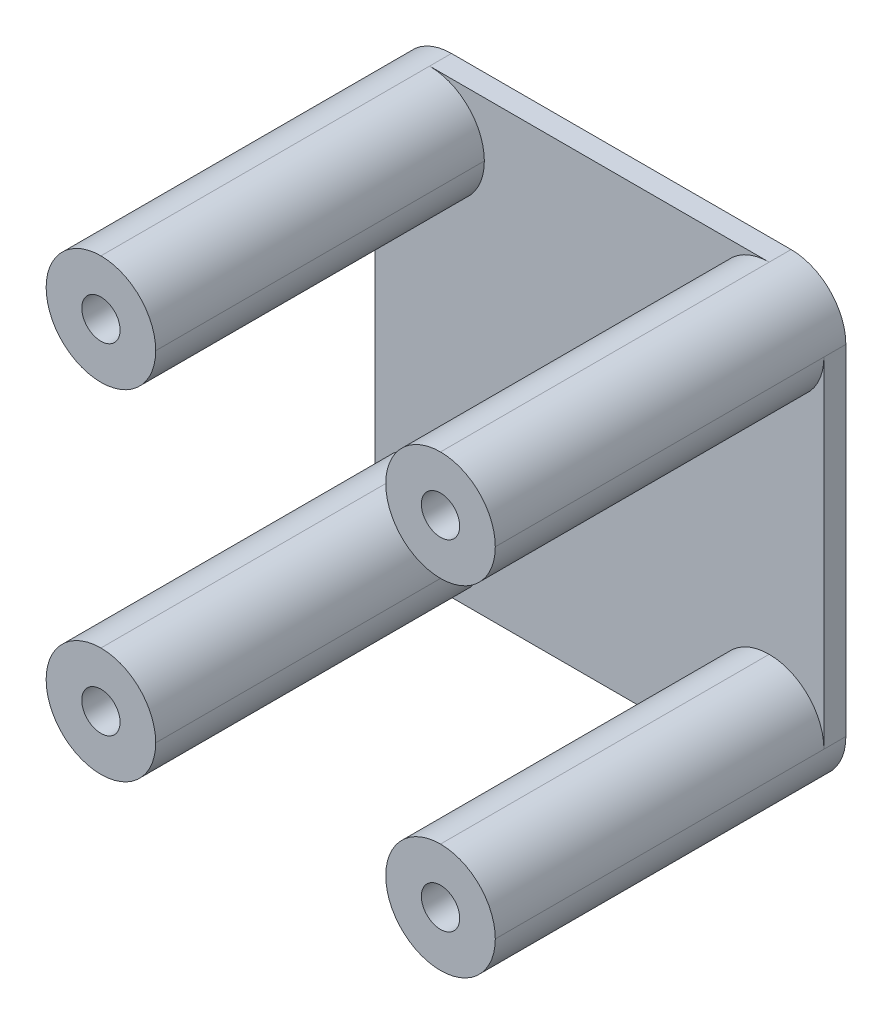
from build123d import *

# Parameters (mm, degrees)
SKETCH1_W           = 41
SKETCH1_H           = 41
SKETCH1_R           = 1.75
SKETCH1_R_2         = 1.25
BOSS_EXTRUDE1_DEPTH = 2
SKETCH2_W           = 10
SKETCH2_H           = 10
SKETCH2_R           = 1.75
BOSS_EXTRUDE2_DEPTH = 30
FILLET1_R           = 5


with BuildPart() as part:
    # Sketch1 → Boss-Extrude1 (new body)
    with BuildSketch(Plane.XY):
        with Locations((-34.508333333, 4.35625)):
            Rectangle(SKETCH1_W, SKETCH1_H)
        with Locations((-50.008333333, 19.85625)):
            Circle(SKETCH1_R, mode=Mode.SUBTRACT)
        with Locations((-50.008333333, -11.14375)):
            Circle(SKETCH1_R, mode=Mode.SUBTRACT)
        with Locations((-19.008333333, -11.14375)):
            Circle(SKETCH1_R, mode=Mode.SUBTRACT)
        with Locations((-19.008333333, 19.85625)):
            Circle(SKETCH1_R, mode=Mode.SUBTRACT)
        with Locations((-34.508333333, 4.35625)):
            Circle(SKETCH1_R_2, mode=Mode.SUBTRACT)
    extrude(amount=BOSS_EXTRUDE1_DEPTH)

    # Sketch2 → Boss-Extrude2 (add)
    # profile 1 of 4: a face of its own
    with BuildSketch(Plane.XY.offset(2)):
        with Locations((-50.008333333, 19.85625)):
            Rectangle(SKETCH2_W, SKETCH2_H)
        with Locations((-50.008333333, 19.85625)):
            Circle(SKETCH2_R, mode=Mode.SUBTRACT)
    # profile 2 of 4: a face of its own
    with BuildSketch(Plane.XY.offset(2)):
        with Locations((-50.008333333, -11.14375)):
            Rectangle(SKETCH2_W, SKETCH2_H)
        with Locations((-50.008333333, -11.14375)):
            Circle(SKETCH2_R, mode=Mode.SUBTRACT)
    # profile 3 of 4: a face of its own
    with BuildSketch(Plane.XY.offset(2)):
        with Locations((-19.008333333, -11.14375)):
            Rectangle(SKETCH2_W, SKETCH2_H)
        with Locations((-19.008333333, -11.14375)):
            Circle(SKETCH2_R, mode=Mode.SUBTRACT)
    # profile 4 of 4: a face of its own
    with BuildSketch(Plane.XY.offset(2)):
        with Locations((-19.008333333, 19.85625)):
            Rectangle(SKETCH2_W, SKETCH2_H)
        with Locations((-19.008333333, 19.85625)):
            Circle(SKETCH2_R, mode=Mode.SUBTRACT)
    extrude(amount=BOSS_EXTRUDE2_DEPTH)

    # Fillet1
    fillet1_edges = [part.edges().sort_by_distance(p)[0] for p in [
        (-24.008333333, 24.85625, 17),
        (-24.008333333, -6.14375, 17),
        (-55.008333333, -6.14375, 17),
        (-55.008333333, 14.85625, 17),
        (-45.008333333, 24.85625, 17),
        (-45.008333333, -6.14375, 17),
        (-45.008333333, -16.14375, 17),
        (-24.008333333, -16.14375, 17),
        (-14.008333333, -6.14375, 17),
        (-14.008333333, 14.85625, 17),
        (-24.008333333, 14.85625, 17),
        (-45.008333333, 14.85625, 17),
        (-14.008333333, -16.14375, 16),
        (-14.008333333, 24.85625, 16),
        (-55.008333333, -16.14375, 16),
        (-55.008333333, 24.85625, 16),
    ]]
    fillet(fillet1_edges, radius=FILLET1_R - 0.0001)  # a hair under: the kernel refuses the full size


solid = part.part
